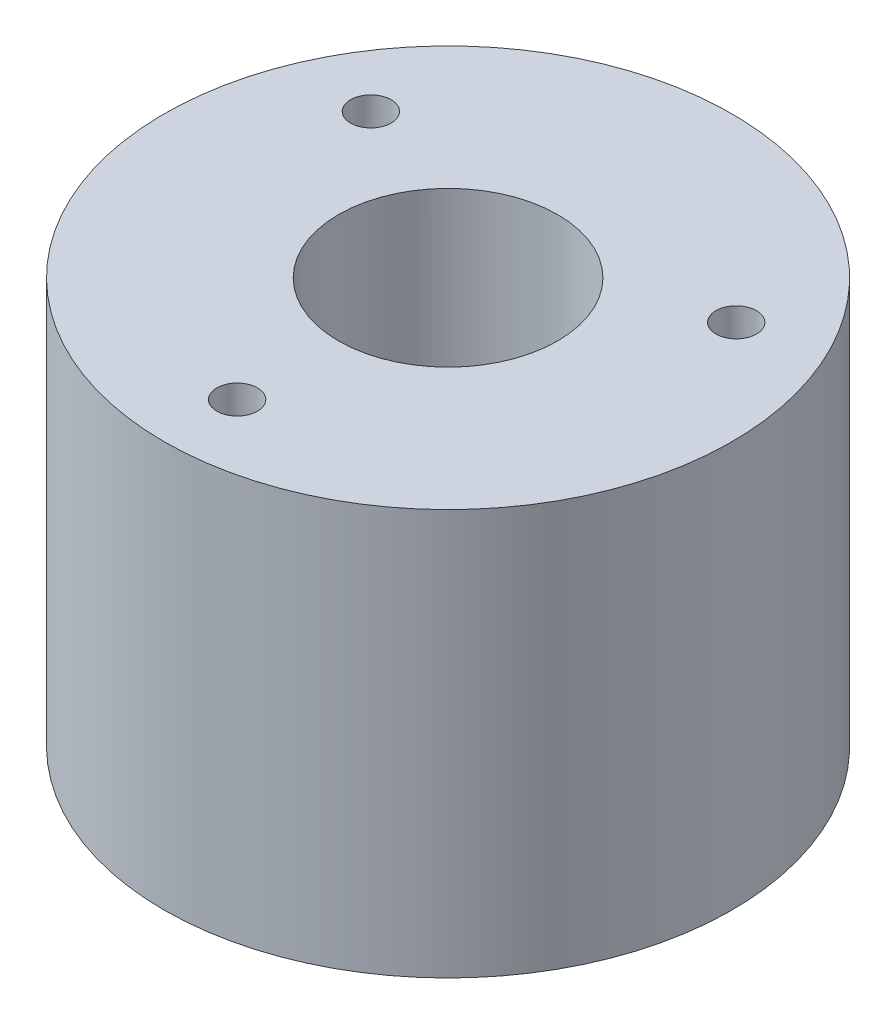
from build123d import *

# Parameters (mm, degrees)
SKETCH1_R           = 22.225
SKETCH1_R_2         = 8.5725
BOSS_EXTRUDE1_DEPTH = 31.75
SKETCH2_R           = 8.5725
CUT_EXTRUDE1_DEPTH  = 9.921875
FILLET1_R           = 3.175
SKETCH3_R           = 1.5875
CUT_EXTRUDE2_DEPTH  = 45.676210112


with BuildPart() as part:
    # Sketch1 → Boss-Extrude1 (new body)
    with BuildSketch(Plane(origin=(0, 0, 0), x_dir=(1, 0, 0), z_dir=(0, 1, 0))):
        Circle(SKETCH1_R)
        Circle(SKETCH1_R_2, mode=Mode.SUBTRACT)
    extrude(amount=BOSS_EXTRUDE1_DEPTH)

    # Sketch2 → Cut-Extrude1 (cut)
    with BuildSketch(Plane.XZ):
        with BuildLine():
            Line((5.334, 11.988389665), (-5.334, 11.988389665))
            ThreePointArc((-5.334, 11.988389665), (-7.71525, 13.363204993), (-7.71525, 10.613574336))
            Line((-7.71525, 10.613574336), (-13.04925, 1.374815329))
            ThreePointArc((-13.04925, 1.374815329), (-15.4305, 0), (-13.04925, -1.374815329))
            Line((-13.04925, -1.374815329), (-7.71525, -10.613574336))
            ThreePointArc((-7.71525, -10.613574336), (-7.71525, -13.363204993), (-5.334, -11.988389665))
            Line((-5.334, -11.988389665), (5.334, -11.988389665))
            ThreePointArc((5.334, -11.988389665), (7.71525, -13.363204993), (7.71525, -10.613574336))
            Line((7.71525, -10.613574336), (13.04925, -1.374815329))
            ThreePointArc((13.04925, -1.374815329), (15.4305, 0), (13.04925, 1.374815329))
            Line((13.04925, 1.374815329), (7.71525, 10.613574336))
            ThreePointArc((7.71525, 10.613574336), (7.71525, 13.363204993), (5.334, 11.988389665))
        make_face()
        Circle(SKETCH2_R, mode=Mode.SUBTRACT)
    extrude(amount=-CUT_EXTRUDE1_DEPTH, mode=Mode.SUBTRACT)

    # Fillet1
    fillet1_edges = [part.edges().sort_by_distance(p)[0] for p in [
        (-13.04925, 4.9609375, -1.374815329),
        (-7.71525, 4.9609375, -10.613574336),
        (-5.334, 4.9609375, -11.988389665),
        (5.334, 4.9609375, -11.988389665),
        (7.71525, 4.9609375, -10.613574336),
        (13.04925, 4.9609375, -1.374815329),
        (13.04925, 4.9609375, 1.374815329),
        (7.71525, 4.9609375, 10.613574336),
        (5.334, 4.9609375, 11.988389665),
        (-5.334, 4.9609375, 11.988389665),
        (-7.71525, 4.9609375, 10.613574336),
        (-13.04925, 4.9609375, 1.374815329),
    ]]
    fillet(fillet1_edges, radius=FILLET1_R)

    # Sketch3 → Cut-Extrude2 (cut, through all)
    with BuildSketch(Plane.XZ):
        with Locations((0, 16.51)):
            Circle(SKETCH3_R)
        with Locations((14.298079416, -8.255)):
            Circle(SKETCH3_R)
        with Locations((-14.298079416, -8.255)):
            Circle(SKETCH3_R)
    extrude(amount=-CUT_EXTRUDE2_DEPTH, mode=Mode.SUBTRACT)


solid = part.part
